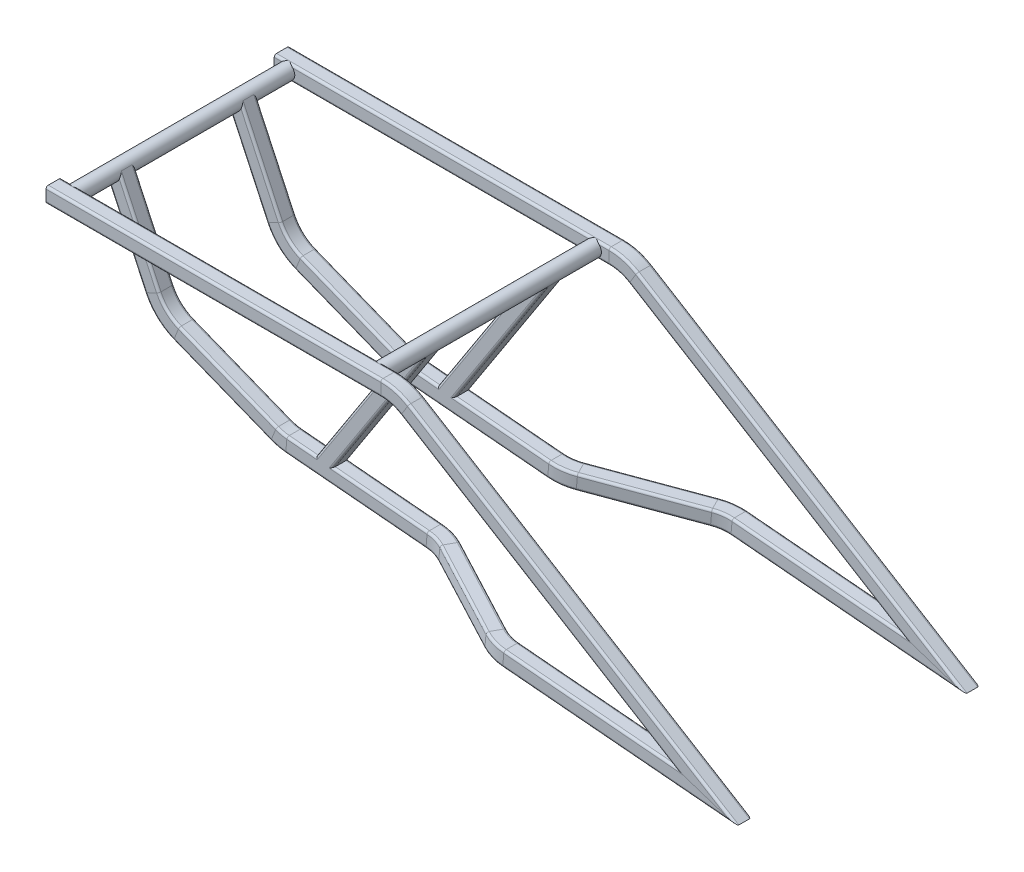
from build123d import *

# Parameters (mm, degrees)
SWEEP3_PROFILE_R = 12.7
SWEEP4_PROFILE_R = 12.7


with BuildPart() as part:
    # Sweep1: sweep along a curve in space
    with BuildLine() as sweep1_path:
        Line((558.899377375, 0, 190.5), (0, 0, 190.5))
        ThreePointArc((598.713768007, -11.228819476, 190.5), (579.583139655, -2.860910982, 190.5), (558.899377375, 0, 190.5))
        Line((1100.15944419, -318.515125051, 190.5), (598.713768007, -11.228819476, 190.5))
        Line((1100.15944419, -318.515125051, 190.5), (763.39908744, -289.05241151, 190.5))
        ThreePointArc((763.39908744, -289.05241151, 190.5), (746.358882993, -287.561586797, 188.55529526), (730.188446692, -286.146856936, 182.820442889))
        Line((730.188446692, -286.146856936, 182.820442889), (579.610900626, -272.973028674, 109.279557111))
        ThreePointArc((579.610900626, -272.973028674, 109.279557111), (563.440464325, -271.558298813, 103.54470474), (546.400259878, -270.0674741, 101.6))
        Line((546.400259878, -270.0674741, 101.6), (312.312994357, -249.587492091, 101.6))
        ThreePointArc((312.312994357, -249.587492091, 101.6), (301.435016807, -247.836178102, 101.6), (290.92332092, -244.534398909, 101.6))
        Line((290.92332092, -244.534398909, 101.6), (128.697677258, -180.358084333, 101.6))
        ThreePointArc((128.697677258, -180.358084333, 101.6), (104.477145937, -164.964856116, 101.6), (87.66796492, -141.704653065, 101.6))
        Line((87.66796492, -141.704653065, 101.6), (21.59, 0, 101.6))
    # 3DSketch2 → Sweep1 (sweep)
    with BuildSketch(Plane(origin=(0, 8.89, 177.8), x_dir=(0, -0.5734623443633282, 0.8192319205190406), z_dir=(-1, 0, 0))):
        with BuildLine():
            Line((0, 0), (10.196160483, -14.565943547))
            ThreePointArc((10.196160483, -14.565943547), (12.655311978, -16.133077374), (15.502325632, -15.502325632))
            Line((15.502325632, -15.502325632), (30.068269179, -5.306165149))
            ThreePointArc((30.068269179, -5.306165149), (31.635403006, -2.847013654), (31.004651264, 0))
            Line((31.004651264, 0), (20.808490781, 14.565943547))
            ThreePointArc((20.808490781, 14.565943547), (18.349339286, 16.133077374), (15.502325632, 15.502325632))
            Line((15.502325632, 15.502325632), (0.936382085, 5.306165149))
            ThreePointArc((0.936382085, 5.306165149), (-0.630751742, 2.847013654), (0, 0))
        make_face()
    sweep(path=sweep1_path.line, transition=Transition.RIGHT)

    # Sweep2: sweep along a curve in space
    with BuildLine() as sweep2_path:
        Line((368.14390924, -254.472064218, 101.6), (533.4, 0, 101.6))
    # 3DSketch3 → Sweep2 (sweep)
    with BuildSketch(Plane(origin=(544.051116213, -6.916915745, 92.71), x_dir=(-0.6870657000607152, 0.4461856826449968, 0.5734623443633398), z_dir=(0.5446390350150306, 0.8386705679454218, -1.3987606740098125e-15))):
        with BuildLine():
            Line((0, 0), (10.196160483, 14.565943547))
            ThreePointArc((10.196160483, 14.565943547), (12.655311978, 16.133077374), (15.502325632, 15.502325632))
            Line((15.502325632, 15.502325632), (30.068269179, 5.306165149))
            ThreePointArc((30.068269179, 5.306165149), (31.635403006, 2.847013654), (31.004651264, 0))
            Line((31.004651264, 0), (20.808490781, -14.565943547))
            ThreePointArc((20.808490781, -14.565943547), (18.349339286, -16.133077374), (15.502325632, -15.502325632))
            Line((15.502325632, -15.502325632), (0.936382085, -5.306165149))
            ThreePointArc((0.936382085, -5.306165149), (-0.630751742, -2.847013654), (0, 0))
        make_face()
    sweep(path=sweep2_path.line)

    # Sweep3: sweep along a curve in space
    with BuildLine() as sweep3_path:
        Line((21.59, 0, 0), (21.59, 0, 190.5))
    # Sweep3 profile (on start of the path) → Sweep3 (sweep)
    with BuildSketch(Plane(origin=(21.59, 0, 0), x_dir=(0, 1, 0), z_dir=(0, 0, 1))):
        Circle(SWEEP3_PROFILE_R)
    sweep(path=sweep3_path.line)

    # Sweep4: sweep along a curve in space
    with BuildLine() as sweep4_path:
        Line((533.4, 0, 190.5), (533.4, 0, 0))
    # Sweep4 profile (on start of the path) → Sweep4 (sweep)
    with BuildSketch(Plane(origin=(533.4, 0, 190.5), x_dir=(0, -1, 0), z_dir=(0, 0, -1))):
        Circle(SWEEP4_PROFILE_R)
    sweep(path=sweep4_path.line)

    # Mirror3: part across plane


with BuildPart() as part_1:
    add(part.part)
    add(part.part.mirror(Plane.XY))


solid = part_1.part
